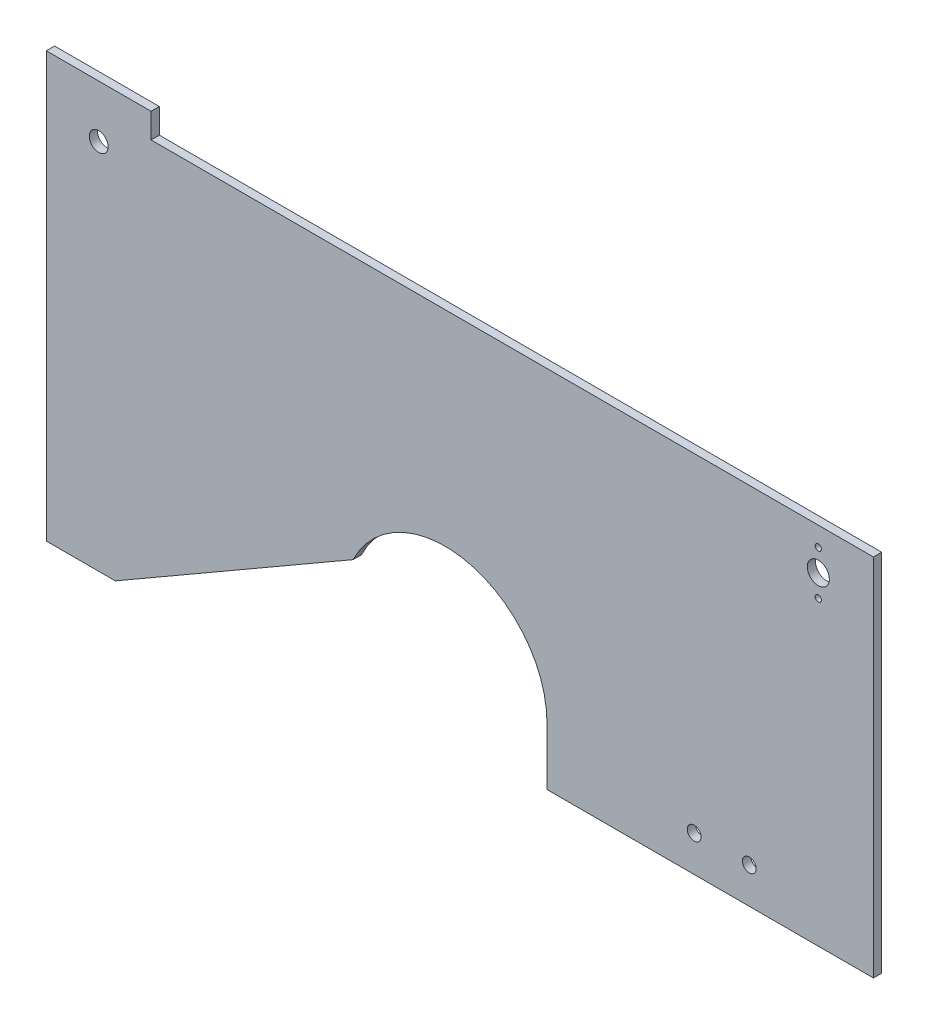
from build123d import *

# Parameters (mm, degrees)
SKETCH2_R           = 3.425
BOSS_EXTRUDE2_DEPTH = 3
SKETCH3_W           = 118.4
SKETCH3_H           = 12.75
CUT_EXTRUDE1_DEPTH  = 338.231374578
SKETCH5_R           = 2.5
SKETCH5_R_2         = 4
SKETCH5_R_3         = 1.125
CUT_EXTRUDE2_DEPTH  = 338.231374578


with BuildPart() as part:
    # Sketch2 → Boss-Extrude2 (new body)
    with BuildSketch(Plane.XY):
        with BuildLine():
            Line((25.03035901, 0), (111.286489227, 49.8))
            ThreePointArc((111.286489227, 49.8), (152.858332199, 69.766604349), (181.6, 33.7))
            Line((181.6, 33.7), (181.6, 0))
            Line((181.6, 0), (300, 0))
            Line((300, 0), (300, 145))
            Line((300, 145), (38, 145))
            Line((38, 145), (38, 154))
            Line((38, 154), (19, 154))
            Line((19, 154), (0, 154))
            Line((0, 154), (0, 0))
            Line((0, 0), (25.03035901, 0))
        make_face()
        with Locations((19, 135)):
            Circle(SKETCH2_R, mode=Mode.SUBTRACT)
    extrude(amount=BOSS_EXTRUDE2_DEPTH)

    # Sketch3 → Cut-Extrude1 (cut, through all)
    with BuildSketch(Plane.XY.offset(3)):
        with Locations((240.8, 6.375)):
            Rectangle(SKETCH3_W, SKETCH3_H)
    extrude(amount=-CUT_EXTRUDE1_DEPTH, mode=Mode.SUBTRACT)

    # Sketch5 → Cut-Extrude2 (cut, through all)
    with BuildSketch(Plane.XY.offset(3)):
        with Locations((254.98, 25.75)):
            Circle(SKETCH5_R)
        with Locations((234.98, 25.75)):
            Circle(SKETCH5_R)
        with Locations((280, 130)):
            Circle(SKETCH5_R_2)
        with Locations((280, 138)):
            Circle(SKETCH5_R_3)
        with Locations((280, 122)):
            Circle(SKETCH5_R_3)
    extrude(amount=-CUT_EXTRUDE2_DEPTH, mode=Mode.SUBTRACT)


solid = part.part
